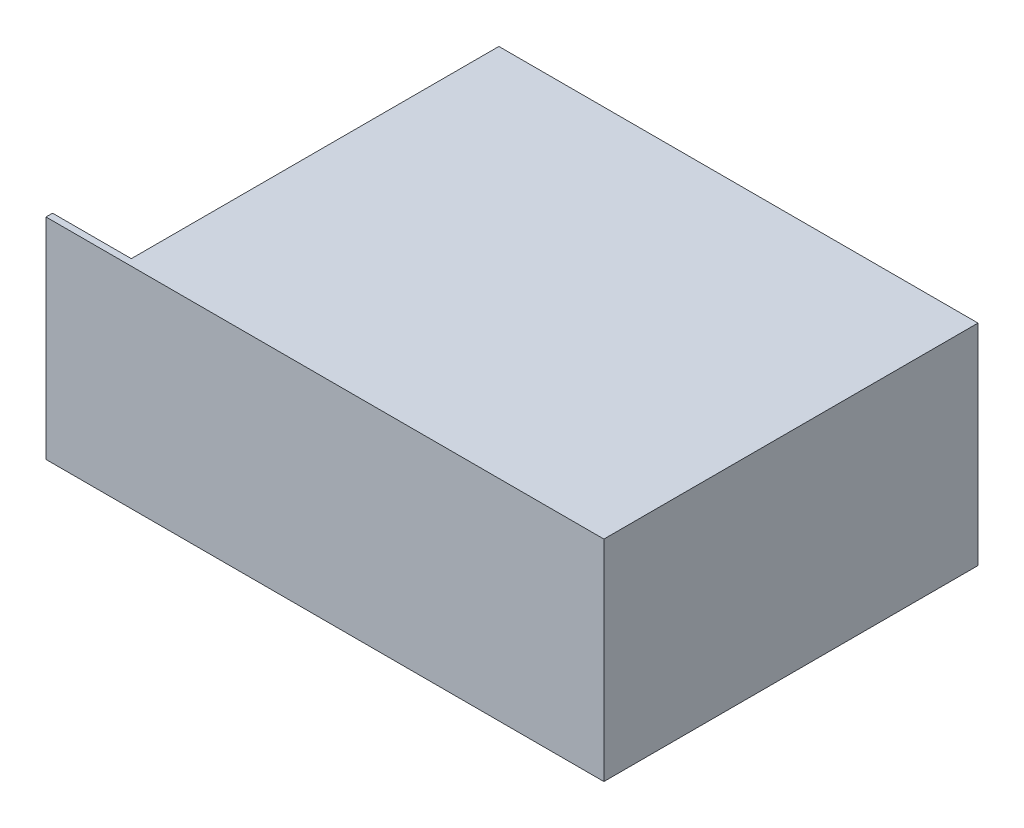
from build123d import *

# Parameters (mm, degrees)
SKETCH_1_W            = 85
SKETCH_1_H            = 57
EXTRUDE_1_DEPTH       = 32
HOLE_WIZARD_M32_D     = 2.5
HOLE_WIZARD_M32_DEPTH = 5.5
HOLE_WIZARD_M32_TIP   = 0.751075774
SKETCH_7_W            = 12
SKETCH_7_H            = 56
CUT_EXTRUDE_1_DEPTH   = 14


with BuildPart() as part:
    # Эскиз1 → Бобышка-Вытянуть1 (new body)
    with BuildSketch(Plane(origin=(0, 0, 0), x_dir=(1, 0, 0), z_dir=(0, 1, 0))):
        Rectangle(SKETCH_1_W, SKETCH_1_H)
    extrude(amount=EXTRUDE_1_DEPTH)

    # Отверстие обработанное метчиком M32
    with Locations(Plane(origin=(0, 0, 0), x_dir=(-1, 0, 0), z_dir=(0, -1, 0))):
        with Locations((-30, 23.5), (37.5, 23.5)):
            Hole(HOLE_WIZARD_M32_D / 2, depth=HOLE_WIZARD_M32_DEPTH)
            with Locations((0, 0, -(HOLE_WIZARD_M32_DEPTH + HOLE_WIZARD_M32_TIP / 2))):  # 118° drill point
                Cone(0, HOLE_WIZARD_M32_D / 2, HOLE_WIZARD_M32_TIP, mode=Mode.SUBTRACT)

    # Эскиз7 → Вырез-Вытянуть1 (cut)
    with BuildSketch(Plane(origin=(0, 32, 0), x_dir=(1, 0, 0), z_dir=(0, 1, 0))):
        with Locations((-36.5, 0.5)):
            Rectangle(SKETCH_7_W, SKETCH_7_H)
    extrude(amount=-CUT_EXTRUDE_1_DEPTH, mode=Mode.SUBTRACT)


solid = part.part
